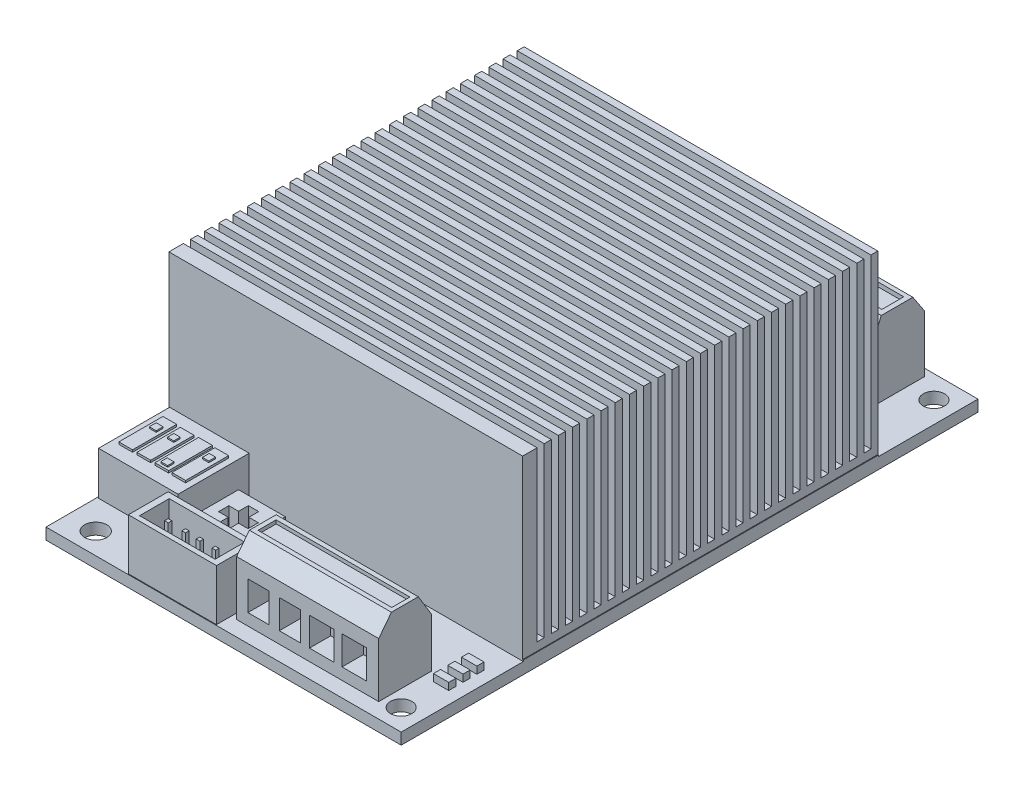
from build123d import *

# Parameters (mm, degrees)
SKETCH1_W            = 50
SKETCH1_H            = 74
BOSS_EXTRUDE1_DEPTH  = 26.6
CUT_EXTRUDE1_DEPTH   = 100
SKETCH3_W            = 0.1
SKETCH3_H            = 24.696632779
CUT_EXTRUDE2_DEPTH   = 60
SKETCH4_W            = 10
SKETCH4_H            = 18.9
CUT_EXTRUDE3_DEPTH   = 99.94953275
SKETCH5_W            = 10
SKETCH5_H            = 5.796632779
CUT_EXTRUDE4_DEPTH   = 0.1
SKETCH8_W            = 0.2
SKETCH8_H            = 10.289914482
CUT_EXTRUDE6_DEPTH   = 0.303367221
SKETCH9_W            = 50
SKETCH9_H            = 1.6
BOSS_EXTRUDE2_DEPTH  = 7.2
SKETCH14_W           = 10
SKETCH14_H           = 6.1
CUT_EXTRUDE9_DEPTH   = 38.6
SKETCH15_W           = 0.1
SKETCH15_H           = 24.809580125
CUT_EXTRUDE10_DEPTH  = 50
SKETCH16_W           = 1
SKETCH16_H           = 23.662723624
CUT_EXTRUDE11_DEPTH  = 99.949532724
SKETCH17_W           = 1
SKETCH17_H           = 23.662723624
CUT_EXTRUDE12_DEPTH  = 99.949532724
SKETCH18_W           = 1
SKETCH18_H           = 23.662723624
CUT_EXTRUDE13_DEPTH  = 99.949532724
SKETCH19_W           = 1
SKETCH19_H           = 23.662723624
CUT_EXTRUDE14_DEPTH  = 99.949532724
SKETCH20_W           = 1
SKETCH20_H           = 23.662723624
CUT_EXTRUDE15_DEPTH  = 99.949532724
SKETCH21_W           = 1
SKETCH21_H           = 23.662723624
CUT_EXTRUDE16_DEPTH  = 99.949532724
SKETCH22_W           = 1
SKETCH22_H           = 23.662723624
CUT_EXTRUDE17_DEPTH  = 99.949532724
SKETCH23_W           = 1
SKETCH23_H           = 23.662723624
CUT_EXTRUDE18_DEPTH  = 99.949532724
SKETCH24_W           = 1
SKETCH24_H           = 23.662723624
CUT_EXTRUDE19_DEPTH  = 99.949532724
SKETCH25_W           = 1
SKETCH25_H           = 23.662723624
CUT_EXTRUDE20_DEPTH  = 99.949532724
SKETCH26_W           = 1
SKETCH26_H           = 23.662723624
CUT_EXTRUDE21_DEPTH  = 99.949532724
SKETCH27_W           = 1
SKETCH27_H           = 23.662723624
CUT_EXTRUDE22_DEPTH  = 99.949532724
SKETCH28_W           = 1
SKETCH28_H           = 23.662723624
CUT_EXTRUDE23_DEPTH  = 99.949532724
SKETCH29_W           = 1
SKETCH29_H           = 23.662723624
CUT_EXTRUDE24_DEPTH  = 99.949532724
SKETCH30_W           = 1
SKETCH30_H           = 23.662723624
CUT_EXTRUDE25_DEPTH  = 99.949532724
SKETCH31_W           = 1
SKETCH31_H           = 23.662723624
CUT_EXTRUDE26_DEPTH  = 99.949532724
SKETCH32_W           = 1
SKETCH32_H           = 23.662723624
CUT_EXTRUDE27_DEPTH  = 99.949532724
SKETCH33_W           = 1
SKETCH33_H           = 23.662723624
CUT_EXTRUDE28_DEPTH  = 99.949532724
SKETCH34_W           = 1
SKETCH34_H           = 23.662723624
CUT_EXTRUDE29_DEPTH  = 99.949532724
SKETCH35_W           = 1
SKETCH35_H           = 23.662723624
CUT_EXTRUDE30_DEPTH  = 99.949532724
SKETCH36_W           = 1
SKETCH36_H           = 23.662723624
CUT_EXTRUDE31_DEPTH  = 99.949532724
SKETCH37_W           = 1
SKETCH37_H           = 23.662723624
CUT_EXTRUDE32_DEPTH  = 99.949532724
SKETCH38_W           = 1
SKETCH38_H           = 23.662723624
CUT_EXTRUDE33_DEPTH  = 99.949532724
SKETCH39_W           = 1
SKETCH39_H           = 23.662723624
CUT_EXTRUDE34_DEPTH  = 99.949532724
SKETCH40_W           = 2.174535043
SKETCH40_H           = 1.005722457
BOSS_EXTRUDE3_DEPTH  = 1
SKETCH41_W           = 2.147353355
SKETCH41_H           = 1.005722457
BOSS_EXTRUDE4_DEPTH  = 1
SKETCH42_W           = 2.147353355
SKETCH42_H           = 1.005722458
BOSS_EXTRUDE5_DEPTH  = 1
SKETCH43_W           = 1.932920038
SKETCH43_H           = 6.108027321
BOSS_EXTRUDE6_DEPTH  = 0.3
SKETCH44_W           = 0.902029351
SKETCH44_H           = 0.902029351
BOSS_EXTRUDE7_DEPTH  = 0.2
SKETCH45_W           = 1.932920039
SKETCH45_H           = 6.159571856
BOSS_EXTRUDE8_DEPTH  = 0.3
SKETCH46_W           = 0.966460019
SKETCH46_H           = 0.902029351
BOSS_EXTRUDE9_DEPTH  = 0.2
SKETCH47_W           = 1.932920038
SKETCH47_H           = 6.056482787
BOSS_EXTRUDE10_DEPTH = 0.3
SKETCH48_W           = 0.902029351
SKETCH48_H           = 0.966460019
BOSS_EXTRUDE11_DEPTH = 0.2
SKETCH49_W           = 1.932920039
SKETCH49_H           = 6.21111639
BOSS_EXTRUDE12_DEPTH = 0.3
SKETCH50_W           = 0.96646002
SKETCH50_H           = 0.966460019
BOSS_EXTRUDE13_DEPTH = 0.2
SKETCH51_W           = 12.4
SKETCH51_H           = 5.6
BOSS_EXTRUDE14_DEPTH = 7.2
SKETCH52_W           = 10.618174077
SKETCH52_H           = 4.164798375
CUT_EXTRUDE35_DEPTH  = 5
SKETCH53_W           = 0.511321781
SKETCH53_H           = 0.51132178
BOSS_EXTRUDE15_DEPTH = 4.4
SKETCH54_W           = 0.511321781
SKETCH54_H           = 0.51132178
BOSS_EXTRUDE16_DEPTH = 4.4
SKETCH55_W           = 0.511321781
SKETCH55_H           = 0.494827529
BOSS_EXTRUDE17_DEPTH = 4.4
SKETCH56_W           = 0.511321781
SKETCH56_H           = 0.478333278
BOSS_EXTRUDE18_DEPTH = 4.4
SKETCH57_W           = 6.6
SKETCH57_H           = 6.6
BOSS_EXTRUDE19_DEPTH = 5
CUT_EXTRUDE36_DEPTH  = 4.3
SKETCH59_W           = 20
SKETCH59_H           = 7.4
BOSS_EXTRUDE20_DEPTH = 10
SKETCH60_W           = 18.823318967
SKETCH60_H           = 2.548283254
CUT_EXTRUDE37_DEPTH  = 0.5
SKETCH61_W           = 2.995617491
SKETCH61_H           = 4.117015551
CUT_EXTRUDE38_DEPTH  = 3
SKETCH62_W           = 2.995617491
SKETCH62_H           = 4.051143302
CUT_EXTRUDE39_DEPTH  = 3
SKETCH63_W           = 3.43519058
SKETCH63_H           = 4.018207178
CUT_EXTRUDE40_DEPTH  = 3
SKETCH64_W           = 3.43519058
SKETCH64_H           = 4.051143302
CUT_EXTRUDE41_DEPTH  = 3
SKETCH65_W           = 30
SKETCH65_H           = 7.5
BOSS_EXTRUDE21_DEPTH = 10.5
SKETCH66_W           = 2.206720335
SKETCH66_H           = 2.997187321
CUT_EXTRUDE42_DEPTH  = 1.3
SKETCH67_W           = 2.206720334
SKETCH67_H           = 3.29361244
CUT_EXTRUDE43_DEPTH  = 1.3
SKETCH68_W           = 2.206720335
SKETCH68_H           = 3.260676316
CUT_EXTRUDE44_DEPTH  = 1.3
SKETCH69_W           = 2.206720334
SKETCH69_H           = 3.227740191
CUT_EXTRUDE45_DEPTH  = 1.3
SKETCH70_W           = 2.206720335
SKETCH70_H           = 3.227740191
CUT_EXTRUDE46_DEPTH  = 1.3
SKETCH71_W           = 2.206720335
SKETCH71_H           = 2.931315072
CUT_EXTRUDE47_DEPTH  = 1.3
SKETCH72_W           = 2.206720335
SKETCH72_H           = 2.931315072
CUT_EXTRUDE48_DEPTH  = 1.3
SKETCH73_W           = 28.402740431
SKETCH73_H           = 3.079175598
CUT_EXTRUDE49_DEPTH  = 0.6
CHAMFER1_SIZE        = 2.522882566
CHAMFER1_SIZE2       = 1.670413038
CHAMFER2_SIZE        = 3.0051793
CHAMFER2_SIZE2       = 1.83114555
CHAMFER3_SIZE        = 3.134470547
CHAMFER3_SIZE2       = 1.378585546
CHAMFER4_SIZE        = 2.314695334
CHAMFER4_SIZE2       = 1.790446572
SKETCH76_R           = 1.56
SKETCH76_R_2         = 1.5
CUT_EXTRUDE50_DEPTH  = 10


with BuildPart() as part:
    # Sketch1 → Boss-Extrude1 (new body)
    with BuildSketch(Plane.XZ):
        with Locations((25, -44.2)):
            Rectangle(SKETCH1_W, SKETCH1_H)
    extrude(amount=-BOSS_EXTRUDE1_DEPTH)

    # Sketch2 → Cut-Extrude1 (cut, through all)
    with BuildSketch(Plane(origin=(50, 0, 0), x_dir=(0, 0, -1), z_dir=(1, 0, 0))):
        with BuildLine():
            Line((67.2, 26.6), (67.2, 1.6))
            add(Edge.make_bspline(
                [(67.2, 1.6), (80, 1.6), (81.2, 1.6)],
                knots=[0, 0, 1, 1.09375, 1.09375], degree=1))
            Line((81.2, 1.6), (81.2, 26.6))
            Line((81.2, 26.6), (67.2, 26.6))
        make_face()
    extrude(amount=-CUT_EXTRUDE1_DEPTH, mode=Mode.SUBTRACT)

    # Sketch3 → Cut-Extrude2 (cut)
    with BuildSketch(Plane(origin=(0, 0, -67.2), x_dir=(-1, 0, 0), z_dir=(0, 0, -1))):
        with Locations((-0.05, 14.251683611)):
            Rectangle(SKETCH3_W, SKETCH3_H)
    extrude(amount=-CUT_EXTRUDE2_DEPTH, mode=Mode.SUBTRACT)

    # Sketch4 → Cut-Extrude3 (cut, through all)
    with BuildSketch(Plane.ZY.offset(-0.1)):
        with Locations((-12.2, 17.15)):
            Rectangle(SKETCH4_W, SKETCH4_H)
    extrude(amount=-CUT_EXTRUDE3_DEPTH, mode=Mode.SUBTRACT)

    # Sketch5 → Cut-Extrude4 (cut)
    with BuildSketch(Plane.ZY.offset(-0.1)):
        with Locations((-12.2, 4.801683611)):
            Rectangle(SKETCH5_W, SKETCH5_H)
    extrude(amount=-CUT_EXTRUDE4_DEPTH, mode=Mode.SUBTRACT)

    # Sketch8 → Cut-Extrude6 (cut)
    with BuildSketch(Plane(origin=(0, 1.903367221, 0), x_dir=(-1, 0, 0), z_dir=(0, 1, 0))):
        with Locations((-0.1, -12.344957241)):
            Rectangle(SKETCH8_W, SKETCH8_H)
    extrude(amount=-CUT_EXTRUDE6_DEPTH, mode=Mode.SUBTRACT)

    # Sketch9 → Boss-Extrude2 (add)
    with BuildSketch(Plane.XY.offset(-7.2)):
        with Locations((25, 0.8)):
            Rectangle(SKETCH9_W, SKETCH9_H)
    extrude(amount=BOSS_EXTRUDE2_DEPTH)

    # Sketch14 → Cut-Extrude9 (cut)
    with BuildSketch(Plane(origin=(50, 0, 0), x_dir=(0, 0, -1), z_dir=(1, 0, 0))):
        with Locations((12.2, 4.65)):
            Rectangle(SKETCH14_W, SKETCH14_H)
    extrude(amount=-CUT_EXTRUDE9_DEPTH, mode=Mode.SUBTRACT)

    # Sketch15 → Cut-Extrude10 (cut)
    with BuildSketch(Plane(origin=(0, 0, -67.2), x_dir=(-1, 0, 0), z_dir=(0, 0, -1))):
        with Locations((-49.95, 14.195209938)):
            Rectangle(SKETCH15_W, SKETCH15_H)
    extrude(amount=-CUT_EXTRUDE10_DEPTH, mode=Mode.SUBTRACT)

    # Sketch16 → Cut-Extrude11 (cut, through all)
    with BuildSketch(Plane.ZY.offset(-0.1)):
        with Locations((-65.733798038, 14.768638188)):
            Rectangle(SKETCH16_W, SKETCH16_H)
    extrude(amount=-CUT_EXTRUDE11_DEPTH, mode=Mode.SUBTRACT)

    # Sketch17 → Cut-Extrude12 (cut, through all)
    with BuildSketch(Plane.ZY.offset(-0.1)):
        with Locations((-63.733798038, 14.768638188)):
            Rectangle(SKETCH17_W, SKETCH17_H)
    extrude(amount=-CUT_EXTRUDE12_DEPTH, mode=Mode.SUBTRACT)

    # Sketch18 → Cut-Extrude13 (cut, through all)
    with BuildSketch(Plane.ZY.offset(-0.1)):
        with Locations((-61.733798038, 14.768638188)):
            Rectangle(SKETCH18_W, SKETCH18_H)
    extrude(amount=-CUT_EXTRUDE13_DEPTH, mode=Mode.SUBTRACT)

    # Sketch19 → Cut-Extrude14 (cut, through all)
    with BuildSketch(Plane.ZY.offset(-0.1)):
        with Locations((-59.733798038, 14.768638188)):
            Rectangle(SKETCH19_W, SKETCH19_H)
    extrude(amount=-CUT_EXTRUDE14_DEPTH, mode=Mode.SUBTRACT)

    # Sketch20 → Cut-Extrude15 (cut, through all)
    with BuildSketch(Plane.ZY.offset(-0.1)):
        with Locations((-57.733798038, 14.768638188)):
            Rectangle(SKETCH20_W, SKETCH20_H)
    extrude(amount=-CUT_EXTRUDE15_DEPTH, mode=Mode.SUBTRACT)

    # Sketch21 → Cut-Extrude16 (cut, through all)
    with BuildSketch(Plane.ZY.offset(-0.1)):
        with Locations((-55.733798038, 14.768638188)):
            Rectangle(SKETCH21_W, SKETCH21_H)
    extrude(amount=-CUT_EXTRUDE16_DEPTH, mode=Mode.SUBTRACT)

    # Sketch22 → Cut-Extrude17 (cut, through all)
    with BuildSketch(Plane.ZY.offset(-0.1)):
        with Locations((-53.733798038, 14.768638188)):
            Rectangle(SKETCH22_W, SKETCH22_H)
    extrude(amount=-CUT_EXTRUDE17_DEPTH, mode=Mode.SUBTRACT)

    # Sketch23 → Cut-Extrude18 (cut, through all)
    with BuildSketch(Plane.ZY.offset(-0.1)):
        with Locations((-51.733798038, 14.768638188)):
            Rectangle(SKETCH23_W, SKETCH23_H)
    extrude(amount=-CUT_EXTRUDE18_DEPTH, mode=Mode.SUBTRACT)

    # Sketch24 → Cut-Extrude19 (cut, through all)
    with BuildSketch(Plane.ZY.offset(-0.1)):
        with Locations((-49.733798038, 14.768638188)):
            Rectangle(SKETCH24_W, SKETCH24_H)
    extrude(amount=-CUT_EXTRUDE19_DEPTH, mode=Mode.SUBTRACT)

    # Sketch25 → Cut-Extrude20 (cut, through all)
    with BuildSketch(Plane.ZY.offset(-0.1)):
        with Locations((-47.733798038, 14.768638188)):
            Rectangle(SKETCH25_W, SKETCH25_H)
    extrude(amount=-CUT_EXTRUDE20_DEPTH, mode=Mode.SUBTRACT)

    # Sketch26 → Cut-Extrude21 (cut, through all)
    with BuildSketch(Plane.ZY.offset(-0.1)):
        with Locations((-45.733798038, 14.768638188)):
            Rectangle(SKETCH26_W, SKETCH26_H)
    extrude(amount=-CUT_EXTRUDE21_DEPTH, mode=Mode.SUBTRACT)

    # Sketch27 → Cut-Extrude22 (cut, through all)
    with BuildSketch(Plane.ZY.offset(-0.1)):
        with Locations((-43.733798038, 14.768638188)):
            Rectangle(SKETCH27_W, SKETCH27_H)
    extrude(amount=-CUT_EXTRUDE22_DEPTH, mode=Mode.SUBTRACT)

    # Sketch28 → Cut-Extrude23 (cut, through all)
    with BuildSketch(Plane.ZY.offset(-0.1)):
        with Locations((-41.733798038, 14.768638188)):
            Rectangle(SKETCH28_W, SKETCH28_H)
    extrude(amount=-CUT_EXTRUDE23_DEPTH, mode=Mode.SUBTRACT)

    # Sketch29 → Cut-Extrude24 (cut, through all)
    with BuildSketch(Plane.ZY.offset(-0.1)):
        with Locations((-39.733798038, 14.768638188)):
            Rectangle(SKETCH29_W, SKETCH29_H)
    extrude(amount=-CUT_EXTRUDE24_DEPTH, mode=Mode.SUBTRACT)

    # Sketch30 → Cut-Extrude25 (cut, through all)
    with BuildSketch(Plane.ZY.offset(-0.1)):
        with Locations((-37.733798038, 14.768638188)):
            Rectangle(SKETCH30_W, SKETCH30_H)
    extrude(amount=-CUT_EXTRUDE25_DEPTH, mode=Mode.SUBTRACT)

    # Sketch31 → Cut-Extrude26 (cut, through all)
    with BuildSketch(Plane.ZY.offset(-0.1)):
        with Locations((-35.733798038, 14.768638188)):
            Rectangle(SKETCH31_W, SKETCH31_H)
    extrude(amount=-CUT_EXTRUDE26_DEPTH, mode=Mode.SUBTRACT)

    # Sketch32 → Cut-Extrude27 (cut, through all)
    with BuildSketch(Plane.ZY.offset(-0.1)):
        with Locations((-33.733798038, 14.768638188)):
            Rectangle(SKETCH32_W, SKETCH32_H)
    extrude(amount=-CUT_EXTRUDE27_DEPTH, mode=Mode.SUBTRACT)

    # Sketch33 → Cut-Extrude28 (cut, through all)
    with BuildSketch(Plane.ZY.offset(-0.1)):
        with Locations((-31.733798038, 14.768638188)):
            Rectangle(SKETCH33_W, SKETCH33_H)
    extrude(amount=-CUT_EXTRUDE28_DEPTH, mode=Mode.SUBTRACT)

    # Sketch34 → Cut-Extrude29 (cut, through all)
    with BuildSketch(Plane.ZY.offset(-0.1)):
        with Locations((-29.733798038, 14.768638188)):
            Rectangle(SKETCH34_W, SKETCH34_H)
    extrude(amount=-CUT_EXTRUDE29_DEPTH, mode=Mode.SUBTRACT)

    # Sketch35 → Cut-Extrude30 (cut, through all)
    with BuildSketch(Plane.ZY.offset(-0.1)):
        with Locations((-27.733798038, 14.768638188)):
            Rectangle(SKETCH35_W, SKETCH35_H)
    extrude(amount=-CUT_EXTRUDE30_DEPTH, mode=Mode.SUBTRACT)

    # Sketch36 → Cut-Extrude31 (cut, through all)
    with BuildSketch(Plane.ZY.offset(-0.1)):
        with Locations((-25.733798038, 14.768638188)):
            Rectangle(SKETCH36_W, SKETCH36_H)
    extrude(amount=-CUT_EXTRUDE31_DEPTH, mode=Mode.SUBTRACT)

    # Sketch37 → Cut-Extrude32 (cut, through all)
    with BuildSketch(Plane.ZY.offset(-0.1)):
        with Locations((-23.733798038, 14.768638188)):
            Rectangle(SKETCH37_W, SKETCH37_H)
    extrude(amount=-CUT_EXTRUDE32_DEPTH, mode=Mode.SUBTRACT)

    # Sketch38 → Cut-Extrude33 (cut, through all)
    with BuildSketch(Plane.ZY.offset(-0.1)):
        with Locations((-21.733798038, 14.768638188)):
            Rectangle(SKETCH38_W, SKETCH38_H)
    extrude(amount=-CUT_EXTRUDE33_DEPTH, mode=Mode.SUBTRACT)

    # Sketch39 → Cut-Extrude34 (cut, through all)
    with BuildSketch(Plane.ZY.offset(-0.1)):
        with Locations((-19.733798038, 14.768638188)):
            Rectangle(SKETCH39_W, SKETCH39_H)
    extrude(amount=-CUT_EXTRUDE34_DEPTH, mode=Mode.SUBTRACT)

    # Sketch40 → Boss-Extrude3 (add)
    with BuildSketch(Plane(origin=(0, 1.6, 0), x_dir=(-1, 0, 0), z_dir=(0, 1, 0))):
        with Locations((-47.195659953, -12.879904173)):
            Rectangle(SKETCH40_W, SKETCH40_H)
    extrude(amount=BOSS_EXTRUDE3_DEPTH)

    # Sketch41 → Boss-Extrude4 (add)
    with BuildSketch(Plane(origin=(0, 1.6, 0), x_dir=(-1, 0, 0), z_dir=(0, 1, 0))):
        with Locations((-47.209250798, -10.922822634)):
            Rectangle(SKETCH41_W, SKETCH41_H)
    extrude(amount=BOSS_EXTRUDE4_DEPTH)

    # Sketch42 → Boss-Extrude5 (add)
    with BuildSketch(Plane(origin=(0, 1.6, 0), x_dir=(-1, 0, 0), z_dir=(0, 1, 0))):
        with Locations((-47.209250798, -8.911377719)):
            Rectangle(SKETCH42_W, SKETCH42_H)
    extrude(amount=BOSS_EXTRUDE5_DEPTH)

    # Sketch43 → Boss-Extrude6 (add)
    with BuildSketch(Plane(origin=(0, 7.7, 0), x_dir=(-1, 0, 0), z_dir=(0, 1, 0))):
        with Locations((-4.661334172, -12.15862791)):
            Rectangle(SKETCH43_W, SKETCH43_H)
    extrude(amount=BOSS_EXTRUDE6_DEPTH)

    # Sketch44 → Boss-Extrude7 (add)
    with BuildSketch(Plane(origin=(0, 8, 0), x_dir=(-1, 0, 0), z_dir=(0, 1, 0))):
        with Locations((-4.638599395, -13.35243412)):
            Rectangle(SKETCH44_W, SKETCH44_H)
    extrude(amount=BOSS_EXTRUDE7_DEPTH)

    # Sketch45 → Boss-Extrude8 (add)
    with BuildSketch(Plane(origin=(0, 7.7, 0), x_dir=(-1, 0, 0), z_dir=(0, 1, 0))):
        with Locations((-7.187016356, -12.184400177)):
            Rectangle(SKETCH45_W, SKETCH45_H)
    extrude(amount=BOSS_EXTRUDE8_DEPTH)

    # Sketch46 → Boss-Extrude9 (add)
    with BuildSketch(Plane(origin=(0, 8, 0), x_dir=(-1, 0, 0), z_dir=(0, 1, 0))):
        with Locations((-7.18361078, -9.905393386)):
            Rectangle(SKETCH46_W, SKETCH46_H)
    extrude(amount=BOSS_EXTRUDE9_DEPTH)

    # Sketch47 → Boss-Extrude10 (add)
    with BuildSketch(Plane(origin=(0, 7.7, 0), x_dir=(-1, 0, 0), z_dir=(0, 1, 0))):
        with Locations((-9.583837203, -12.132855643)):
            Rectangle(SKETCH47_W, SKETCH47_H)
    extrude(amount=BOSS_EXTRUDE10_DEPTH)

    # Sketch48 → Boss-Extrude11 (add)
    with BuildSketch(Plane(origin=(0, 8, 0), x_dir=(-1, 0, 0), z_dir=(0, 1, 0))):
        with Locations((-9.567545494, -13.384649454)):
            Rectangle(SKETCH48_W, SKETCH48_H)
    extrude(amount=BOSS_EXTRUDE11_DEPTH)

    # Sketch49 → Boss-Extrude12 (add)
    with BuildSketch(Plane(origin=(0, 7.7, 0), x_dir=(-1, 0, 0), z_dir=(0, 1, 0))):
        with Locations((-2.109879722, -12.210172444)):
            Rectangle(SKETCH49_W, SKETCH49_H)
    extrude(amount=BOSS_EXTRUDE12_DEPTH)

    # Sketch50 → Boss-Extrude13 (add)
    with BuildSketch(Plane(origin=(0, 8, 0), x_dir=(-1, 0, 0), z_dir=(0, 1, 0))):
        with Locations((-2.125803346, -13.384649454)):
            Rectangle(SKETCH50_W, SKETCH50_H)
    extrude(amount=BOSS_EXTRUDE13_DEPTH)

    # Sketch51 → Boss-Extrude14 (add)
    with BuildSketch(Plane(origin=(0, 1.6, 0), x_dir=(-1, 0, 0), z_dir=(0, 1, 0))):
        with Locations((-17.7, -2.9)):
            Rectangle(SKETCH51_W, SKETCH51_H)
    extrude(amount=BOSS_EXTRUDE14_DEPTH)

    # Sketch52 → Cut-Extrude35 (cut)
    with BuildSketch(Plane(origin=(0, 8.8, 0), x_dir=(-1, 0, 0), z_dir=(0, 1, 0))):
        with Locations((-17.714870151, -2.854434251)):
            Rectangle(SKETCH52_W, SKETCH52_H)
    extrude(amount=-CUT_EXTRUDE35_DEPTH, mode=Mode.SUBTRACT)

    # Sketch53 → Boss-Extrude15 (add)
    with BuildSketch(Plane(origin=(0, 3.8, 0), x_dir=(-1, 0, 0), z_dir=(0, 1, 0))):
        with Locations((-14.439140495, -2.764527042)):
            Rectangle(SKETCH53_W, SKETCH53_H)
    extrude(amount=BOSS_EXTRUDE15_DEPTH)

    # Sketch54 → Boss-Extrude16 (add)
    with BuildSketch(Plane(origin=(0, 3.8, 0), x_dir=(-1, 0, 0), z_dir=(0, 1, 0))):
        with Locations((-16.880289641, -2.764527042)):
            Rectangle(SKETCH54_W, SKETCH54_H)
    extrude(amount=BOSS_EXTRUDE16_DEPTH)

    # Sketch55 → Boss-Extrude17 (add)
    with BuildSketch(Plane(origin=(0, 3.8, 0), x_dir=(-1, 0, 0), z_dir=(0, 1, 0))):
        with Locations((-18.892588263, -2.756279917)):
            Rectangle(SKETCH55_W, SKETCH55_H)
    extrude(amount=BOSS_EXTRUDE17_DEPTH)

    # Sketch56 → Boss-Extrude18 (add)
    with BuildSketch(Plane(origin=(0, 3.8, 0), x_dir=(-1, 0, 0), z_dir=(0, 1, 0))):
        with Locations((-21.102817896, -2.748032791)):
            Rectangle(SKETCH56_W, SKETCH56_H)
    extrude(amount=BOSS_EXTRUDE18_DEPTH)

    # Sketch57 → Boss-Extrude19 (add)
    with BuildSketch(Plane(origin=(0, 1.6, 0), x_dir=(-1, 0, 0), z_dir=(0, 1, 0))):
        with Locations((-17.3, -9.8)):
            Rectangle(SKETCH57_W, SKETCH57_H)
    extrude(amount=BOSS_EXTRUDE19_DEPTH)

    # Sketch58 → Cut-Extrude36 (cut)
    with BuildSketch(Plane(origin=(0, 6.6, 0), x_dir=(-1, 0, 0), z_dir=(0, 1, 0))):
        Polygon((-18.086121358, -10.470977555), (-18.086121358, -11.856494638), (-16.634627271, -11.856494638), (-16.634627271, -10.470977555), (-15.265604438, -10.470977555), (-15.265604438, -9.019483468), (-16.634627271, -9.019483468), (-16.634627271, -7.518506627), (-18.086121358, -7.518506627), (-18.086121358, -9.019483468), (-19.422155688, -9.019483468), (-19.422155688, -10.470977555), align=None)
    extrude(amount=-CUT_EXTRUDE36_DEPTH, mode=Mode.SUBTRACT)

    # Sketch59 → Boss-Extrude20 (add)
    with BuildSketch(Plane(origin=(0, 1.6, 0), x_dir=(-1, 0, 0), z_dir=(0, 1, 0))):
        with Locations((-34.7, -5.835866507)):
            Rectangle(SKETCH59_W, SKETCH59_H)
    extrude(amount=BOSS_EXTRUDE20_DEPTH)

    # Sketch60 → Cut-Extrude37 (cut)
    with BuildSketch(Plane(origin=(0, 11.6, 0), x_dir=(-1, 0, 0), z_dir=(0, 1, 0))):
        with Locations((-34.733446605, -5.80267787)):
            Rectangle(SKETCH60_W, SKETCH60_H)
    extrude(amount=-CUT_EXTRUDE37_DEPTH, mode=Mode.SUBTRACT)

    # Sketch61 → Cut-Extrude38 (cut)
    with BuildSketch(Plane.XY.offset(-2.135866507)):
        with Locations((27.784820018, 5.303211921)):
            Rectangle(SKETCH61_W, SKETCH61_H)
    extrude(amount=-CUT_EXTRUDE38_DEPTH, mode=Mode.SUBTRACT)

    # Sketch62 → Cut-Extrude39 (cut)
    with BuildSketch(Plane.XY.offset(-2.135866507)):
        with Locations((32.208834631, 5.270275796)):
            Rectangle(SKETCH62_W, SKETCH62_H)
    extrude(amount=-CUT_EXTRUDE39_DEPTH, mode=Mode.SUBTRACT)

    # Sketch63 → Cut-Extrude40 (cut)
    with BuildSketch(Plane.XY.offset(-2.135866507)):
        with Locations((36.665953696, 5.253807734)):
            Rectangle(SKETCH63_W, SKETCH63_H)
    extrude(amount=-CUT_EXTRUDE40_DEPTH, mode=Mode.SUBTRACT)

    # Sketch64 → Cut-Extrude41 (cut)
    with BuildSketch(Plane.XY.offset(-2.135866507)):
        with Locations((41.25390863, 5.270275796)):
            Rectangle(SKETCH64_W, SKETCH64_H)
    extrude(amount=-CUT_EXTRUDE41_DEPTH, mode=Mode.SUBTRACT)

    # Sketch65 → Boss-Extrude21 (add)
    with BuildSketch(Plane(origin=(0, 1.6, 0), x_dir=(-1, 0, 0), z_dir=(0, 1, 0))):
        with Locations((-28.5, -76.45)):
            Rectangle(SKETCH65_W, SKETCH65_H)
    extrude(amount=BOSS_EXTRUDE21_DEPTH)

    # Sketch66 → Cut-Extrude42 (cut)
    with BuildSketch(Plane(origin=(0, 0, -80.2), x_dir=(-1, 0, 0), z_dir=(0, 0, -1))):
        with Locations((-41.025225715, 4.865779019)):
            Rectangle(SKETCH66_W, SKETCH66_H)
    extrude(amount=-CUT_EXTRUDE42_DEPTH, mode=Mode.SUBTRACT)

    # Sketch67 → Cut-Extrude43 (cut)
    with BuildSketch(Plane(origin=(0, 0, -80.2), x_dir=(-1, 0, 0), z_dir=(0, 0, -1))):
        with Locations((-27.356734089, 5.013991578)):
            Rectangle(SKETCH67_W, SKETCH67_H)
    extrude(amount=-CUT_EXTRUDE43_DEPTH, mode=Mode.SUBTRACT)

    # Sketch68 → Cut-Extrude44 (cut)
    with BuildSketch(Plane(origin=(0, 0, -80.2), x_dir=(-1, 0, 0), z_dir=(0, 0, -1))):
        with Locations((-23.700824281, 4.997523516)):
            Rectangle(SKETCH68_W, SKETCH68_H)
    extrude(amount=-CUT_EXTRUDE44_DEPTH, mode=Mode.SUBTRACT)

    # Sketch69 → Cut-Extrude45 (cut)
    with BuildSketch(Plane(origin=(0, 0, -80.2), x_dir=(-1, 0, 0), z_dir=(0, 0, -1))):
        with Locations((-19.979042223, 4.981055453)):
            Rectangle(SKETCH69_W, SKETCH69_H)
    extrude(amount=-CUT_EXTRUDE45_DEPTH, mode=Mode.SUBTRACT)

    # Sketch70 → Cut-Extrude46 (cut)
    with BuildSketch(Plane(origin=(0, 0, -80.2), x_dir=(-1, 0, 0), z_dir=(0, 0, -1))):
        with Locations((-16.158451793, 4.981055453)):
            Rectangle(SKETCH70_W, SKETCH70_H)
    extrude(amount=-CUT_EXTRUDE46_DEPTH, mode=Mode.SUBTRACT)

    # Sketch71 → Cut-Extrude47 (cut)
    with BuildSketch(Plane(origin=(0, 0, -80.2), x_dir=(-1, 0, 0), z_dir=(0, 0, -1))):
        with Locations((-33.614597726, 4.832842894)):
            Rectangle(SKETCH71_W, SKETCH71_H)
    extrude(amount=-CUT_EXTRUDE47_DEPTH, mode=Mode.SUBTRACT)

    # Sketch72 → Cut-Extrude48 (cut)
    with BuildSketch(Plane(origin=(0, 0, -80.2), x_dir=(-1, 0, 0), z_dir=(0, 0, -1))):
        with Locations((-37.138763037, 4.832842894)):
            Rectangle(SKETCH72_W, SKETCH72_H)
    extrude(amount=-CUT_EXTRUDE48_DEPTH, mode=Mode.SUBTRACT)

    # Sketch73 → Cut-Extrude49 (cut)
    with BuildSketch(Plane(origin=(0, 12.1, 0), x_dir=(-1, 0, 0), z_dir=(0, 1, 0))):
        with Locations((-28.604261308, -76.405785319)):
            Rectangle(SKETCH73_W, SKETCH73_H)
    extrude(amount=-CUT_EXTRUDE49_DEPTH, mode=Mode.SUBTRACT)

    # Chamfer1
    chamfer1_edges = [part.edges().sort_by_distance(p)[0] for p in [
        (28.5, 12.1, -80.2),
    ]]
    chamfer1_side = [part.faces().sort_by_distance(p)[0] for p in [
        (28.573603423, 7.196844904, -80.2),
    ]]
    chamfer(chamfer1_edges, length=CHAMFER1_SIZE, length2=CHAMFER1_SIZE2, reference=chamfer1_side[0])

    # Chamfer2
    chamfer2_edges = [part.edges().sort_by_distance(p)[0] for p in [
        (34.7, 11.6, -9.535866507),
    ]]
    chamfer2_side = [part.faces().sort_by_distance(p)[0] for p in [
        (34.7, 6.6, -9.535866507),
    ]]
    chamfer(chamfer2_edges, length=CHAMFER2_SIZE, length2=CHAMFER2_SIZE2, reference=chamfer2_side[0])

    # Chamfer3
    chamfer3_edges = [part.edges().sort_by_distance(p)[0] for p in [
        (28.5, 12.1, -72.7),
    ]]
    chamfer3_side = [part.faces().sort_by_distance(p)[0] for p in [
        (28.5, 6.85, -72.7),
    ]]
    chamfer(chamfer3_edges, length=CHAMFER3_SIZE, length2=CHAMFER3_SIZE2, reference=chamfer3_side[0])

    # Chamfer4
    chamfer4_edges = [part.edges().sort_by_distance(p)[0] for p in [
        (34.7, 11.6, -2.135866507),
    ]]
    chamfer4_side = [part.faces().sort_by_distance(p)[0] for p in [
        (34.680875079, 7.068280948, -2.135866507),
    ]]
    chamfer(chamfer4_edges, length=CHAMFER4_SIZE, length2=CHAMFER4_SIZE2, reference=chamfer4_side[0])

    # Sketch76 → Cut-Extrude50 (cut)
    with BuildSketch(Plane.XZ):
        with Locations((4, -3)):
            Circle(SKETCH76_R)
        with Locations((47, -3)):
            Circle(SKETCH76_R_2)
        with Locations((47, -78)):
            Circle(SKETCH76_R_2)
        with Locations((11.5, -78)):
            Circle(SKETCH76_R_2)
    extrude(amount=-CUT_EXTRUDE50_DEPTH, mode=Mode.SUBTRACT)


solid = part.part
